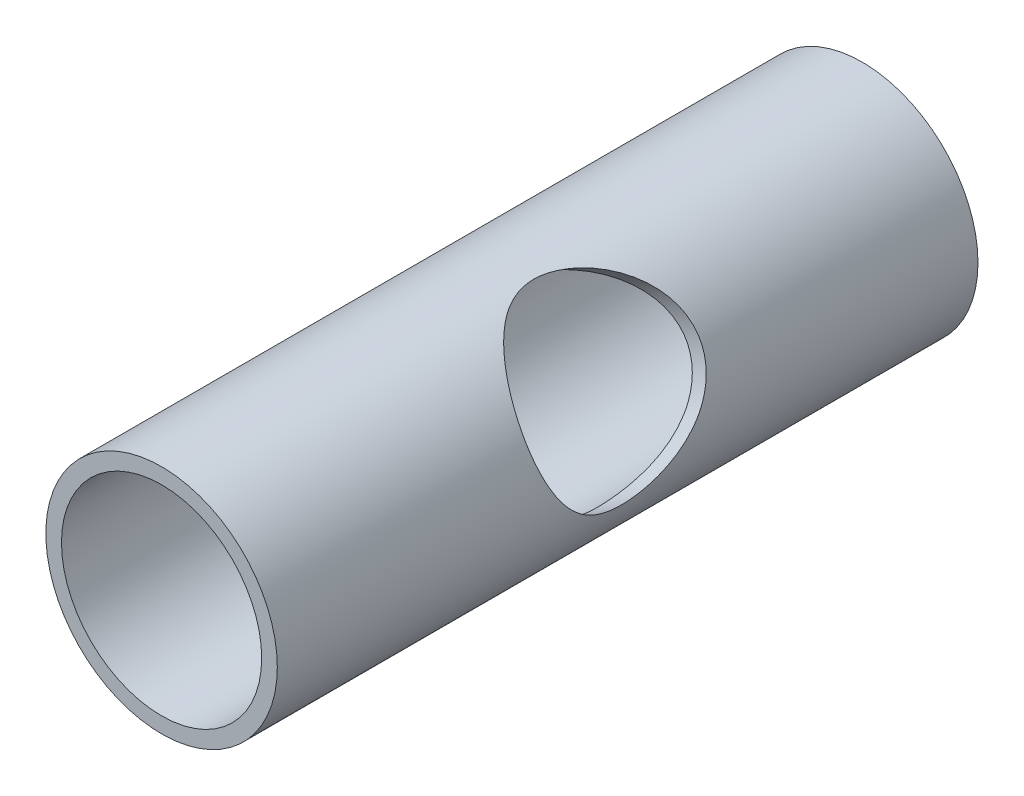
from build123d import *

# Parameters (mm, degrees)
SKETCH1_R           = 185
SKETCH1_R_2         = 160
BOSS_EXTRUDE1_DEPTH = 1120
SKETCH4_R           = 140
CUT_EXTRUDE1_DEPTH  = 200


with BuildPart() as part:
    # Sketch1 → Boss-Extrude1 (new body)
    with BuildSketch(Plane.XY):
        Circle(SKETCH1_R)
        Circle(SKETCH1_R_2, mode=Mode.SUBTRACT)
    extrude(amount=BOSS_EXTRUDE1_DEPTH)

    # Sketch4 → Cut-Extrude1 (cut)
    with BuildSketch(Plane(origin=(160.2146997, 92.5, 1120), x_dir=(0, 0, -1), z_dir=(0.8660254037844397, 0.49999999999999806, 0))):
        with Locations((560, 0)):
            Circle(SKETCH4_R)
    extrude(amount=-CUT_EXTRUDE1_DEPTH, mode=Mode.SUBTRACT)


solid = part.part
